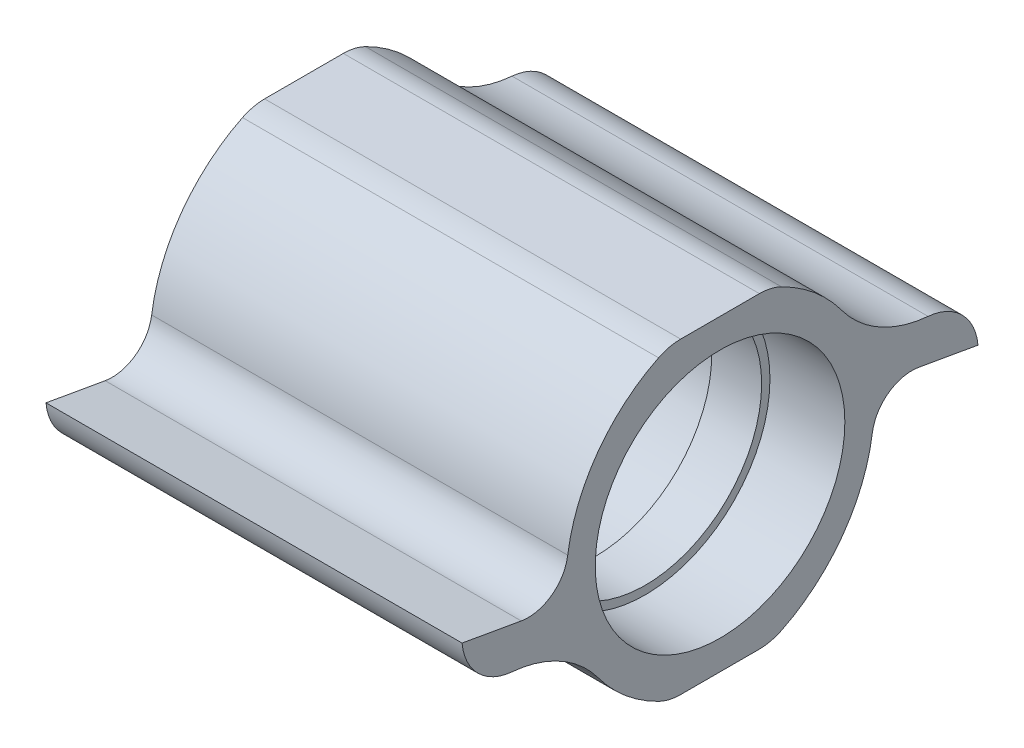
from build123d import *

# Parameters (mm, degrees)
BOSS_EXTRUDE1_DEPTH      = 25
FILLET2_R                = 6
CIRPATTERN1_COUNT        = 2
FILLET2_OF_CIRPATTERN1_R = 6
FILLET1_R                = 4.8
SKETCH4_R                = 14
CUT_EXTRUDE1_DEPTH       = 62.670495538
SKETCH5_R                = 17.5
CUT_EXTRUDE2_DEPTH       = 25
SKETCH6_R                = 15
CUT_EXTRUDE3_DEPTH       = 10
CUT_EXTRUDE4_START       = -9
SKETCH7_R                = 15
CUT_EXTRUDE4_DEPTH       = 9


with BuildPart() as part:
    # Sketch1 → Boss-Extrude1 (new, symmetric)
    with BuildSketch(Plane(origin=(0, 0, 0), x_dir=(0, 0, -1), z_dir=(1, 0, 0))):
        with BuildLine():
            Line((-31, 0), (-18.365369315, -2.227826281))
            ThreePointArc((-18.365369315, -2.227826281), (-18.466311656, -1.115945268), (-18.5, 0))
            Line((-18.5, 0), (18.5, 0))
            ThreePointArc((18.5, 0), (15.082064036, -11.163556781), (6, -18.5))
            Line((6, -18.5), (-6, -18.5))
            ThreePointArc((-6, -18.5), (-10.769673076, -15.764754466), (-14.610997182, -11.830853286))
            ThreePointArc((-14.610997182, -11.830853286), (-19.177732459, -7.79691726), (-25, -6))
            ThreePointArc((-25, -6), (-29.091910703, -4.091910703), (-31, 0))
        make_face()
    boss_extrude1 = extrude(amount=BOSS_EXTRUDE1_DEPTH, both=True)

    # Fillet2
    fillet2_edges = [part.edges().sort_by_distance(p)[0] for p in [
        (0, -18.5, -6),
        (0, -18.5, 6),
    ]]
    fillet(fillet2_edges, radius=FILLET2_R)

    # CirPattern1: Boss-Extrude1 ×2 about axis
    cirpattern1_axis = Axis((-27.5, 0, 0), (1, 0, 0))
    for i in range(1, CIRPATTERN1_COUNT):
        add(boss_extrude1.rotate(cirpattern1_axis, i * 360 / CIRPATTERN1_COUNT))

    # Fillet2 of CirPattern1
    fillet2_of_cirpattern1_edges = [part.edges().sort_by_distance(p)[0] for p in [
        (0, 18.5, 6),
        (0, 18.5, -6),
    ]]
    fillet(fillet2_of_cirpattern1_edges, radius=FILLET2_OF_CIRPATTERN1_R)

    # Fillet1
    fillet1_edges = [part.edges().sort_by_distance(p)[0] for p in [
        (0, 2.227826281, -18.365369315),
        (0, -2.227826281, 18.365369315),
    ]]
    fillet(fillet1_edges, radius=FILLET1_R)

    # Sketch4 → Cut-Extrude1 (cut, through all)
    with BuildSketch(Plane(origin=(25, 0, 0), x_dir=(0, 0, -1), z_dir=(1, 0, 0))):
        Circle(SKETCH4_R)
    extrude(amount=-CUT_EXTRUDE1_DEPTH, mode=Mode.SUBTRACT)

    # Sketch5 → Cut-Extrude2 (cut)
    with BuildSketch(Plane.ZY.offset(25)):
        Circle(SKETCH5_R)
    extrude(amount=-CUT_EXTRUDE2_DEPTH, mode=Mode.SUBTRACT)

    # Sketch6 → Cut-Extrude3 (cut)
    with BuildSketch(Plane.ZY):
        Circle(SKETCH6_R)
    extrude(amount=-CUT_EXTRUDE3_DEPTH, mode=Mode.SUBTRACT)

    # Sketch7 → Cut-Extrude4 (cut)
    with BuildSketch(Plane(origin=(25, 0, 0), x_dir=(0, 0, -1), z_dir=(1, 0, 0)).offset(CUT_EXTRUDE4_START)):
        Circle(SKETCH7_R)
    extrude(amount=CUT_EXTRUDE4_DEPTH, mode=Mode.SUBTRACT)


solid = part.part
